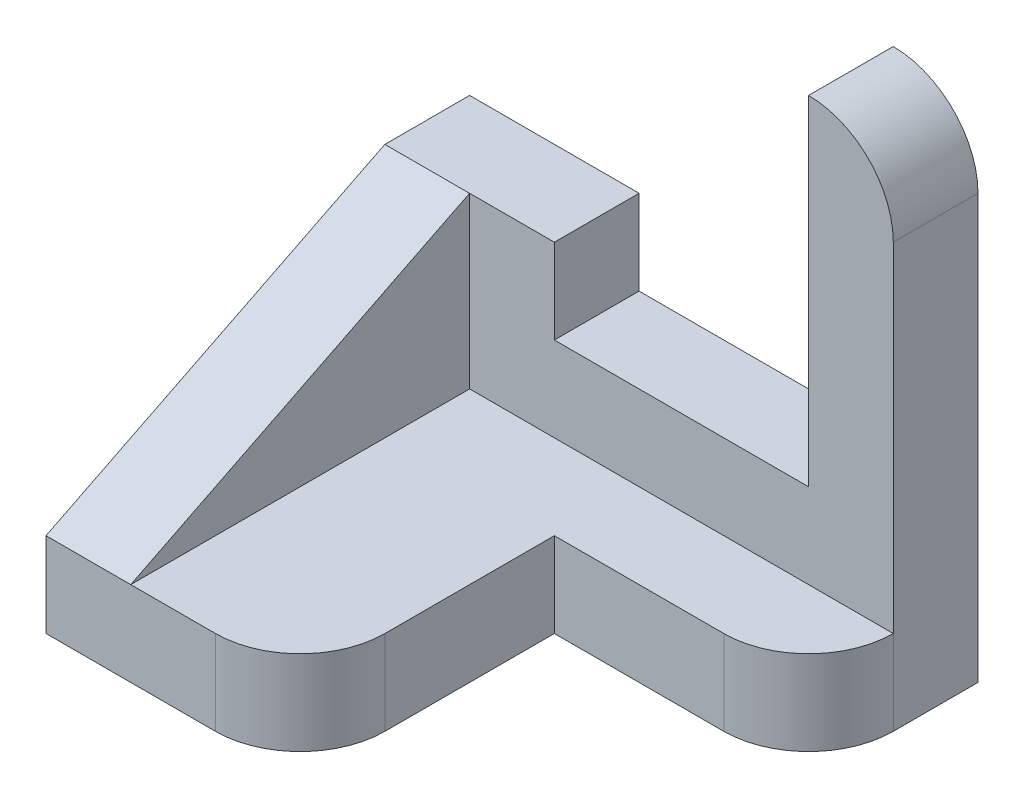
from build123d import *

# Parameters (mm, degrees)
SKETCH1_W           = 10
SKETCH1_H           = 10
BOSS_EXTRUDE1_DEPTH = 20
SKETCH1_3_W         = 10
SKETCH1_3_H         = 10
BOSS_EXTRUDE2_DEPTH = 20
SKETCH1_4_W         = 10
SKETCH1_4_H         = 40
BOSS_EXTRUDE3_DEPTH = 20
SKETCH1_5_W         = 10
SKETCH1_5_H         = 10
BOSS_EXTRUDE4_DEPTH = 50
SKETCH1_6_W         = 30
SKETCH1_6_H         = 10
BOSS_EXTRUDE5_DEPTH = 10
CHAMFER1_SIZE2      = 39.991364166
CHAMFER1_SIZE       = 20
FILLET1_R           = 10
SKETCH1_7_W         = 10
SKETCH1_7_H         = 40
SKETCH1_7_H_2       = 10
SKETCH1_7_W_2       = 30
BOSS_EXTRUDE6_DEPTH = 10


with BuildPart() as part:
    # Sketch1 → Boss-Extrude1 (new body)
    with BuildSketch(Plane(origin=(0, 0, 0), x_dir=(1, 0, 0), z_dir=(0, 1, 0))):
        with Locations((-47.852369013, 15)):
            Rectangle(SKETCH1_W, SKETCH1_H)
    extrude(amount=BOSS_EXTRUDE1_DEPTH)

    # Sketch1<3> → Boss-Extrude2 (add)
    with BuildSketch(Plane(origin=(0, 0, 0), x_dir=(1, 0, 0), z_dir=(0, 1, 0))):
        with Locations((-37.852369013, 15)):
            Rectangle(SKETCH1_3_W, SKETCH1_3_H)
    extrude(amount=BOSS_EXTRUDE2_DEPTH)

    # Sketch1<4> → Boss-Extrude3 (add)
    with BuildSketch(Plane(origin=(0, 0, 0), x_dir=(1, 0, 0), z_dir=(0, 1, 0))):
        with Locations((-47.852369013, -10)):
            Rectangle(SKETCH1_4_W, SKETCH1_4_H)
    extrude(amount=BOSS_EXTRUDE3_DEPTH)



with BuildPart() as body_2:
    # Sketch1<5> → Boss-Extrude4 (new body)
    with BuildSketch(Plane(origin=(0, 0, 0), x_dir=(1, 0, 0), z_dir=(0, 1, 0))):
        with Locations((2.147630987, 15)):
            Rectangle(SKETCH1_5_W, SKETCH1_5_H)
    extrude(amount=BOSS_EXTRUDE4_DEPTH)


with BuildPart() as part_1:
    add(part.part)

    add(body_2.part)  # Boss-Extrude5 merges body 2
    # Sketch1<6> → Boss-Extrude5 (add)
    with BuildSketch(Plane(origin=(0, 0, 0), x_dir=(1, 0, 0), z_dir=(0, 1, 0))):
        with Locations((-17.852369013, 15)):
            Rectangle(SKETCH1_6_W, SKETCH1_6_H)
    extrude(amount=BOSS_EXTRUDE5_DEPTH)

    # Chamfer1
    chamfer1_edges = [part_1.edges().sort_by_distance(p)[0] for p in [
        (-47.852369013, 20, 30),
    ]]
    chamfer1_side = [part_1.faces().sort_by_distance(p)[0] for p in [
        (-47.852369013, 19.6, 30),
    ]]
    chamfer(chamfer1_edges, length=CHAMFER1_SIZE - 0.0001, length2=CHAMFER1_SIZE2 - 0.0001, reference=chamfer1_side[0])  # a hair under: the kernel refuses the full size

    # Fillet1
    fillet1_edges = [part_1.edges().sort_by_distance(p)[0] for p in [
        (7.147630987, 50, -15),
    ]]
    fillet(fillet1_edges, radius=FILLET1_R - 0.0001)  # a hair under: the kernel refuses the full size

    # Sketch1<7> → Boss-Extrude6 (add)
    with BuildSketch(Plane(origin=(0, 0, 0), x_dir=(1, 0, 0), z_dir=(0, 1, 0))):
        with Locations((-47.852369013, -10)):
            Rectangle(SKETCH1_7_W, SKETCH1_7_H)
        with BuildLine():
            Line((-42.852369013, 10), (-42.852369013, -30))
            Line((-42.852369013, -30), (-32.852369013, -30))
            ThreePointArc((-32.852369013, -30), (-25.781301201, -27.071067812), (-22.852369013, -20))
            Line((-22.852369013, -20), (-22.852369013, 0))
            Line((-22.852369013, 0), (-2.852369013, 0))
            ThreePointArc((-2.852369013, 0), (4.218698799, 2.928932188), (7.147630987, 10))
            Line((7.147630987, 10), (-2.852369013, 10))
            Line((-2.852369013, 10), (-32.852369013, 10))
            Line((-32.852369013, 10), (-42.852369013, 10))
        make_face()
        with Locations((-47.852369013, 15)):
            Rectangle(SKETCH1_7_W, SKETCH1_7_H_2)
        with Locations((-37.852369013, 15)):
            Rectangle(SKETCH1_7_W, SKETCH1_7_H_2)
        with Locations((-17.852369013, 15)):
            Rectangle(SKETCH1_7_W_2, SKETCH1_7_H_2)
        with Locations((2.147630987, 15)):
            Rectangle(SKETCH1_7_W, SKETCH1_7_H_2)
    extrude(amount=-BOSS_EXTRUDE6_DEPTH)


solid = part_1.part
